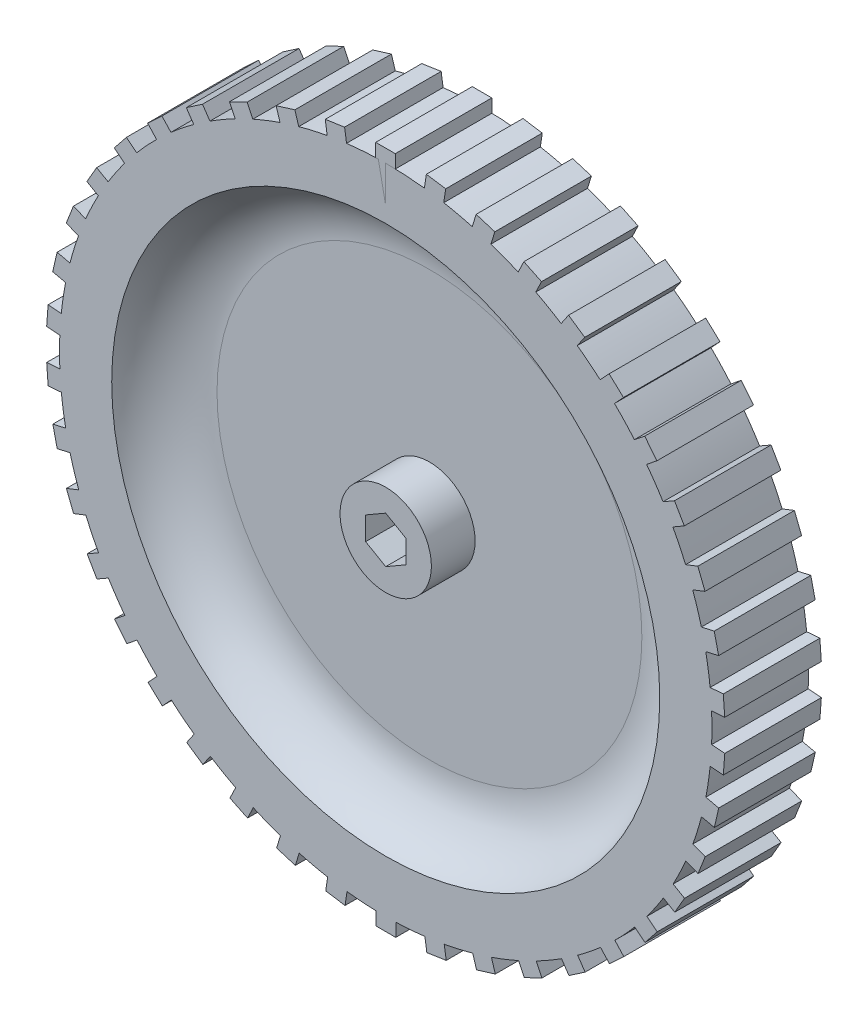
from build123d import *

# Parameters (mm, degrees)
SKETCH1_R           = 50
BOSS_EXTRUDE1_DEPTH = 14.8
CUT_EXTRUDE1_REACH  = 74.243
SKETCH3_R           = 3.550704156
CUT_EXTRUDE3_DEPTH  = 5.5
BOSS_EXTRUDE3_START = 40
SKETCH9_W           = 3
SKETCH9_H           = 14.8
BOSS_EXTRUDE3_DEPTH = 12
CIRPATTERN11_COUNT  = 42
SKETCH12_R          = 42
SKETCH12_R_2        = 7
CUT_EXTRUDE6_DEPTH  = 6.7
FILLET1_R           = 10


with BuildPart() as part:
    # Sketch1 → Boss-Extrude1 (new body)
    with BuildSketch(Plane.XY):
        Circle(SKETCH1_R)
    extrude(amount=BOSS_EXTRUDE1_DEPTH)

    # Sketch2 → Cut-Extrude1 (cut, up to next)
    with BuildSketch(Plane.XY.offset(14.8), mode=Mode.PRIVATE) as cut_extrude1_sk1:
        Polygon((0, -3.550704156), (3.075, -1.775352078), (3.075, 1.775352078), (0, 3.550704156), (-3.075, 1.775352078), (-3.075, -1.775352078), align=None)
    cut_extrude1_tool1 = extrude(cut_extrude1_sk1.sketch, amount=-CUT_EXTRUDE1_REACH, mode=Mode.PRIVATE) & part.part
    add(cut_extrude1_tool1.solids().sort_by_distance((0, 0, 14.8))[0], mode=Mode.SUBTRACT)

    # Sketch3 → Cut-Extrude3 (cut)
    with BuildSketch(Plane(origin=(0, 0, 0), x_dir=(-1, 0, 0), z_dir=(0, 0, -1))):
        Circle(SKETCH3_R)
    extrude(amount=-CUT_EXTRUDE3_DEPTH, mode=Mode.SUBTRACT)


with BuildPart() as body_2:
    # Sketch9 → Boss-Extrude3 (new body)
    with BuildSketch(Plane(origin=(0, 0, 0), x_dir=(1, 0, 0), z_dir=(0, 1, 0)).offset(BOSS_EXTRUDE3_START)):
        with Locations((-0.0375, -7.4)):
            Rectangle(SKETCH9_W, SKETCH9_H)
    boss_extrude3 = extrude(amount=BOSS_EXTRUDE3_DEPTH)


with BuildPart() as part_1:
    add(part.part)

    # CirPattern11: Boss-Extrude3 ×42 about axis
    cirpattern11_axis = Axis((0, 0, 0), (0, 0, 1))
    for i in range(1, CIRPATTERN11_COUNT):
        add(boss_extrude3.rotate(cirpattern11_axis, i * 360 / CIRPATTERN11_COUNT))


with BuildPart() as cut_extrude6_tool:
    # Sketch12 → Cut-Extrude6 (new body)
    with BuildSketch(Plane.XY.offset(14.8)):
        Circle(SKETCH12_R)
        Circle(SKETCH12_R_2, mode=Mode.SUBTRACT)
    extrude(amount=-CUT_EXTRUDE6_DEPTH)


with BuildPart() as part_2:
    add(part_1.part)

    # Cut-Extrude6: cut by cut_extrude6_tool
    add(cut_extrude6_tool.part, mode=Mode.SUBTRACT)

    # Fillet1
    # the kernel refuses this fillet: 10 mm, written as the material it adds along each edge
    with BuildSketch(Plane(origin=(0, 0, 8.1), x_dir=(1, 0, 0), z_dir=(0, -1, 0))) as fillet1_piece_1:
        with BuildLine():
            CenterArc((32.56019068, 10), FILLET1_R, 270, 70.731224509)
            Line((32.56019068, 0), (32.56019068, -0.2))
            Line((32.56019068, -0.2), (42, -0.2))
            Line((42, -0.2), (42.2, 0))
            ThreePointArc((42.2, 0), (42.2, 3.35), (42.188796186, 6.634))
            Line((42.188796186, 6.634), (42, 6.7))
        make_face()
    revolve(axis=Axis((0, 0, 8.1), (0, 0, 1)))


with BuildPart() as body_2_1:
    add(body_2.part)

    # Cut-Extrude6: cut by cut_extrude6_tool
    add(cut_extrude6_tool.part, mode=Mode.SUBTRACT)


solid = Compound([part_2.part, body_2_1.part])
